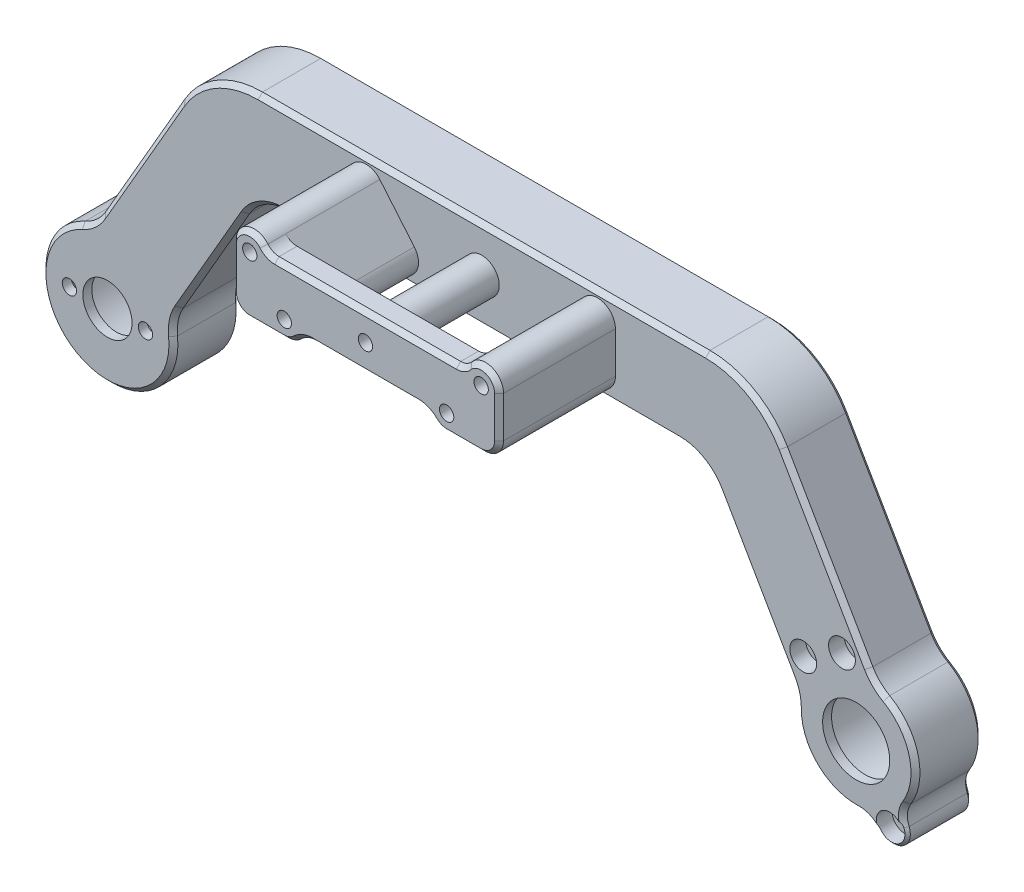
from build123d import *

# Parameters (mm, degrees)
BOSS_EXTRUDE1_DEPTH             = 7.5
CUT_EXTRUDE1_DEPTH              = 111.578168244
CUT_EXTRUDE1_DEPTH_BACK         = 111.578168244
SKETCH3_R                       = 1.6
SKETCH4_R                       = 1.6
BOSS_EXTRUDE2_DEPTH             = 21
BOSS_EXTRUDE2_2_DEPTH           = 21
SKETCH4_R_2                     = 3.9
BOSS_EXTRUDE2_3_DEPTH           = 21
BOSS_EXTRUDE3_START             = 5
SKETCH4_3_R                     = 1.6
SKETCH4_3_R_2                   = 3.9
BOSS_EXTRUDE3_DEPTH             = 5
CHAMFER1_SIZE                   = 1
BOSS_EXTRUDE4_REACH             = 117.298
SKETCH5_R                       = 13.25
SKETCH5_R_2                     = 11.25
BOSS_EXTRUDE4_DIRECTION_2_REACH = 117.298
CUT_EXTRUDE2_DEPTH              = 120.592667834
CUT_EXTRUDE2_DEPTH_BACK         = 120.592667834
SKETCH5_3_R                     = 11.25
BOSS_EXTRUDE5_START             = 5.5
SKETCH5_4_R                     = 11.25
SKETCH5_4_R_2                   = 7.5
BOSS_EXTRUDE5_DEPTH             = 2
CUT_EXTRUDE3_DEPTH              = 120.592667834
CUT_EXTRUDE3_DEPTH_BACK         = 120.592667834
SKETCH5_5_R                     = 12.75
BOSS_EXTRUDE6_START             = -7.5
BOSS_EXTRUDE6_DEPTH             = 15
BOSS_EXTRUDE7_START             = 5.5
SKETCH5_7_R                     = 12.75
SKETCH5_7_R_2                   = 1.6
SKETCH5_7_R_3                   = 5.5
BOSS_EXTRUDE7_DEPTH             = 2
FILLET1_R                       = 10
BOSS_EXTRUDE8_START             = -7.5
BOSS_EXTRUDE8_OUTLINE_R         = 1.6
BOSS_EXTRUDE8_DEPTH             = 15
CUT_EXTRUDE4_DEPTH              = 123.546948151
CUT_EXTRUDE4_DEPTH_BACK         = 123.546948151
SKETCH6_3_R                     = 1.6
CUT_EXTRUDE5_START              = 4
SKETCH7_R                       = 3
CUT_EXTRUDE5_DEPTH              = 3.5
CHAMFER2_SIZE                   = 1


# Read off the part's stored shape, not the designer's step: Boss-Extrude6, Boss-Extrude8
with BuildPart() as part:
    # Sketch1 → Boss-Extrude1 (new, symmetric)
    with BuildSketch(Plane.XY):
        with BuildLine():
            Line((-50, 10), (50, 10))
            ThreePointArc((50, 10), (60, 7.320508076), (67.320508076, 0))
            Line((67.320508076, 0), (92.320508076, -43.301270189))
            ThreePointArc((92.320508076, -43.301270189), (88.660254038, -56.961524227), (75, -53.301270189))
            Line((75, -53.301270189), (50, -10))
            Line((50, -10), (-50, -10))
            Line((-50, -10), (-75, -53.301270189))
            ThreePointArc((-75, -53.301270189), (-88.660254038, -56.961524227), (-92.320508076, -43.301270189))
            Line((-92.320508076, -43.301270189), (-67.320508076, 0))
            ThreePointArc((-67.320508076, 0), (-60, 7.320508076), (-50, 10))
        make_face()
    extrude(amount=BOSS_EXTRUDE1_DEPTH, both=True)

    # Sketch3 → Cut-Extrude1 (cut, two sides: drawn at the far end of the back side and taken through both)
    with BuildSketch(Plane.XY.offset(-CUT_EXTRUDE1_DEPTH_BACK)):
        Circle(SKETCH3_R)
        with Locations((25.856725658, 4.596266659)):
            Circle(SKETCH3_R)
        with Locations((18.143274342, -4.596266659)):
            Circle(SKETCH3_R)
        with Locations(Location((-25.856725658, 4.596266659, 0), (0, 0, 180))):
            Circle(SKETCH3_R)
        with Locations(Location((-18.143274342, -4.596266659, 0), (0, 0, 180))):
            Circle(SKETCH3_R)
    extrude(amount=CUT_EXTRUDE1_DEPTH + CUT_EXTRUDE1_DEPTH_BACK, mode=Mode.SUBTRACT)

    # Boss-Extrude4: up to this face of the body (flat: up to its plane)
    boss_extrude4_end = Plane(part.part.faces().sort_by_distance((0, 8.006158576, 7.5))[0])
    # Sketch5 → Boss-Extrude4 (add, up to the picked face)
    with BuildSketch(Plane.XY, mode=Mode.PRIVATE) as boss_extrude4_sk1:
        with Locations((83.660254038, -48.301270189)):
            Circle(SKETCH5_R)
        with Locations((83.660254038, -48.301270189)):
            Circle(SKETCH5_R_2, mode=Mode.SUBTRACT)
    boss_extrude4_tool1 = split(extrude(boss_extrude4_sk1.sketch, amount=BOSS_EXTRUDE4_REACH, mode=Mode.PRIVATE), bisect_by=boss_extrude4_end, keep=Keep.BOTH, mode=Mode.PRIVATE)
    add(boss_extrude4_tool1.solids().sort_by(Axis((70.785021, -48.30127, 0), (0, 0, 1)))[0])

    # Boss-Extrude4 direction 2: up to this face of the body (flat: up to its plane)
    boss_extrude4_direction_2_end = Plane(part.part.faces().sort_by_distance((0, 8.006158576, -7.5))[0])
    # Sketch5 → Boss-Extrude4 direction 2 (add, up to the picked face)
    with BuildSketch(Plane.XY, mode=Mode.PRIVATE) as boss_extrude4_direction_2_sk1:
        with Locations((83.660254038, -48.301270189)):
            Circle(SKETCH5_R)
        with Locations((83.660254038, -48.301270189)):
            Circle(SKETCH5_R_2, mode=Mode.SUBTRACT)
    boss_extrude4_direction_2_tool1 = split(extrude(boss_extrude4_direction_2_sk1.sketch, amount=-BOSS_EXTRUDE4_DIRECTION_2_REACH, mode=Mode.PRIVATE), bisect_by=boss_extrude4_direction_2_end, keep=Keep.BOTH, mode=Mode.PRIVATE)
    add(boss_extrude4_direction_2_tool1.solids().sort_by(Axis((70.785021, -48.30127, 0), (0, 0, -1)))[0])

    # Sketch5<3> → Cut-Extrude2 (cut, two sides: drawn at the far end of the back side and taken through both)
    with BuildSketch(Plane.XY.offset(-CUT_EXTRUDE2_DEPTH_BACK)):
        with Locations(Location((83.660254038, -48.301270189, 0), (0, 0, 180))):
            Circle(SKETCH5_3_R)
    extrude(amount=CUT_EXTRUDE2_DEPTH + CUT_EXTRUDE2_DEPTH_BACK, mode=Mode.SUBTRACT)

    # Sketch5<4> → Boss-Extrude5 (add)
    with BuildSketch(Plane.XY.offset(BOSS_EXTRUDE5_START)):
        with Locations(Location((83.660254038, -48.301270189, 0), (0, 0, 180))):
            Circle(SKETCH5_4_R)
        with Locations(Location((83.660254038, -48.301270189, 0), (0, 0, 180))):
            Circle(SKETCH5_4_R_2, mode=Mode.SUBTRACT)
    extrude(amount=BOSS_EXTRUDE5_DEPTH)

    # Sketch5<5> → Cut-Extrude3 (cut, two sides: drawn at the far end of the back side and taken through both)
    with BuildSketch(Plane.XY.offset(-CUT_EXTRUDE3_DEPTH_BACK)):
        with Locations((-83.660254038, -48.301270189)):
            Circle(SKETCH5_5_R)
    extrude(amount=CUT_EXTRUDE3_DEPTH + CUT_EXTRUDE3_DEPTH_BACK, mode=Mode.SUBTRACT)

    # Boss-Extrude6 outline → Boss-Extrude6 (add)
    with BuildSketch(Plane.XY.offset(BOSS_EXTRUDE6_START)):
        with BuildLine():
            ThreePointArc((-71.045176995, -46.45131581), (-90.035254038, -59.343094087), (-88.365685071, -36.45131581))
            Line((-88.365685071, -36.45131581), (-86.899195965, -33.91128217))
            ThreePointArc((-86.899195965, -33.91128217), (-91.035254037, -61.075144895), (-69.578687889, -43.91128217))
            Line((-69.578687889, -43.91128217), (-71.045176995, -46.45131581))
        make_face()
    extrude(amount=BOSS_EXTRUDE6_DEPTH)

    # Sketch5<7> → Boss-Extrude7 (add)
    with BuildSketch(Plane.XY.offset(BOSS_EXTRUDE7_START)):
        with Locations((-83.660254038, -48.301270189)):
            Circle(SKETCH5_7_R)
        with Locations(Location((-92.160254038, -48.301270189, 0), (0, 0, 180))):
            Circle(SKETCH5_7_R_2, mode=Mode.SUBTRACT)
        with Locations(Location((-83.660254038, -48.301270189, 0), (0, 0, 180))):
            Circle(SKETCH5_7_R_3, mode=Mode.SUBTRACT)
        with Locations(Location((-75.160254038, -48.301270189, 0), (0, 0, 180))):
            Circle(SKETCH5_7_R_2, mode=Mode.SUBTRACT)
    extrude(amount=BOSS_EXTRUDE7_DEPTH)

    # Fillet1
    fillet1_edges = [part.edges().sort_by_distance(p)[0] for p in [
        (-86.899195965, -33.91128217, 0),
        (-69.578687889, -43.91128217, 0),
        (50, -10, 0),
        (-50, -10, 0),
        (70.653665337, -45.773197727, 0),
        (87.974173413, -35.773197727, 0),
    ]]
    fillet(fillet1_edges, radius=FILLET1_R)

    # Boss-Extrude8 outline → Boss-Extrude8 (add)
    with BuildSketch(Plane.XY.offset(BOSS_EXTRUDE8_START)):
        with BuildLine():
            ThreePointArc((94.877990144, -55.352858426), (90.285254038, -59.776106789), (84.158240535, -61.541908748))
            ThreePointArc((84.158240535, -61.541908748), (86.46915215, -62.011467228), (88.307842566, -63.487954685))
            ThreePointArc((88.307842566, -63.487954685), (92.960254038, -64.4093427), (94.488514346, -59.919542169))
            ThreePointArc((94.488514346, -59.919542169), (94.129183909, -57.58894583), (94.877990144, -55.352858426))
        make_face()
        with Locations((91.160254038, -61.291651246)):
            Circle(BOSS_EXTRUDE8_OUTLINE_R, mode=Mode.SUBTRACT)
    extrude(amount=BOSS_EXTRUDE8_DEPTH)

    # Sketch6<3> → Cut-Extrude4 (cut, two sides: drawn at the far end of the back side and taken through both)
    with BuildSketch(Plane.XY.offset(-CUT_EXTRUDE4_DEPTH_BACK)):
        with Locations((71.830127019, -37.810889132)):
            Circle(SKETCH6_3_R)
        with Locations((80.490381057, -32.810889132)):
            Circle(SKETCH6_3_R)
        with Locations(Location((91.160254038, -61.291651246, 0), (0, 0, 180))):
            Circle(SKETCH6_3_R)
    extrude(amount=CUT_EXTRUDE4_DEPTH + CUT_EXTRUDE4_DEPTH_BACK, mode=Mode.SUBTRACT)

    # Sketch7 → Cut-Extrude5 (cut)
    with BuildSketch(Plane.XY.offset(CUT_EXTRUDE5_START)):
        with Locations(Location((80.490381057, -32.810889132, 0), (0, 0, 180))):
            Circle(SKETCH7_R)
        with Locations(Location((71.830127019, -37.810889132, 0), (0, 0, 180))):
            Circle(SKETCH7_R)
        with Locations(Location((91.160254038, -61.291651246, 0), (0, 0, 180))):
            Circle(SKETCH7_R)
    extrude(amount=CUT_EXTRUDE5_DEPTH, mode=Mode.SUBTRACT)

    # Chamfer2
    # the kernel refuses this chamfer: 1 mm, written as the material it takes off along each edge
    with BuildSketch(Plane(origin=(-85.03074642, -30.675032626, -7.5), x_dir=(-0.023812127644088462, 0.013747938305292346, 0.9996219169112968), z_dir=(0.5000000000000039, 0.8660254037844364, 0))) as chamfer2_piece_1:
        Polygon((CHAMFER2_SIZE * 0.999621916911, CHAMFER2_SIZE * 0.0274958766106), (-CHAMFER2_SIZE * 0.0274958766106, CHAMFER2_SIZE * 0.999621916911), (0, 0), align=None)
    extrude(amount=35.420476688, mode=Mode.SUBTRACT)
    with BuildSketch(Plane(origin=(-50, -10, 7.5), x_dir=(-0.8660254037844343, 0.5000000000000077, 0), z_dir=(-0.5000000000000077, -0.8660254037844343, 0))) as chamfer2_piece_2:
        Polygon((20, CHAMFER2_SIZE), (20 - CHAMFER2_SIZE, 0), (20, 0), align=None)
    revolve(axis=Axis((-50, -10, 7.5), (0, 0, -1)), revolution_arc=60, mode=Mode.SUBTRACT)
    with BuildSketch(Plane(origin=(83.660254038, -48.301270189, 7.5), x_dir=(0.49000237526877505, 0.8717210977319286, 0), z_dir=(-0.8717210977319286, 0.49000237526877505, 0))) as chamfer2_piece_3:
        Polygon((13.25, CHAMFER2_SIZE), (13.25 - CHAMFER2_SIZE, 0), (13.25, 0), align=None)
    revolve(axis=Axis((83.660254038, -48.301270189, 7.5), (0, 0, -1)), revolution_arc=92.813167669, mode=Mode.SUBTRACT)
    with BuildSketch(Plane(origin=(83.660254038, -48.301270189, -7.5), x_dir=(-0.9999338032850952, 0.011506043968479752, 0), z_dir=(0.011506043968479752, 0.9999338032850952, 0))) as chamfer2_piece_4:
        Polygon((13.25, CHAMFER2_SIZE), (13.25 - CHAMFER2_SIZE, 0), (13.25, 0), align=None)
    revolve(axis=Axis((83.660254038, -48.301270189, -7.5), (0, 0, 1)), revolution_arc=92.81316767, mode=Mode.SUBTRACT)
    with BuildSketch(Plane(origin=(-50, -10, -7.5), x_dir=(-0.8660254037844343, 0.5000000000000077, 0), z_dir=(-0.5000000000000077, -0.8660254037844343, 0))) as chamfer2_piece_5:
        Polygon((20, -CHAMFER2_SIZE), (20 - CHAMFER2_SIZE, 0), (20, 0), align=None)
    revolve(axis=Axis((-50, -10, -7.5), (0, 0, -1)), revolution_arc=60, mode=Mode.SUBTRACT)
    with BuildSketch(Plane(origin=(67.320508076, 0, -7.5), x_dir=(0.023812127644087928, 0.013747938305292062, 0.9996219169112968), z_dir=(0.5000000000000047, -0.866025403784436, 0))) as chamfer2_piece_6:
        Polygon((CHAMFER2_SIZE * 0.999621916911, CHAMFER2_SIZE * 0.0274958766106), (-CHAMFER2_SIZE * 0.0274958766106, CHAMFER2_SIZE * 0.999621916911), (0, 0), align=None)
    extrude(amount=38.144094299, mode=Mode.SUBTRACT)
    with BuildSketch(Plane(origin=(67.320508076, 0, 7.5), x_dir=(0.02381212764408793, 0.013747938305292064, -0.9996219169112968), z_dir=(0.5000000000000047, -0.866025403784436, 0))) as chamfer2_piece_7:
        Polygon((CHAMFER2_SIZE * 0.999621916911, -CHAMFER2_SIZE * 0.0274958766106), (-CHAMFER2_SIZE * 0.0274958766106, -CHAMFER2_SIZE * 0.999621916911), (0, 0), align=None)
    extrude(amount=38.144094299, mode=Mode.SUBTRACT)
    with BuildSketch(Plane(origin=(69.072047149, -43.033754667, 7.5), x_dir=(-0.02381212764408995, -0.013747938305293224, -0.9996219169112968), z_dir=(-0.5000000000000044, 0.8660254037844362, 0))) as chamfer2_piece_8:
        Polygon((CHAMFER2_SIZE * 0.999621916911, -CHAMFER2_SIZE * 0.0274958766106), (-CHAMFER2_SIZE * 0.0274958766106, -CHAMFER2_SIZE * 0.999621916911), (0, 0), align=None)
    extrude(amount=32.370591607, mode=Mode.SUBTRACT)
    with BuildSketch(Plane(origin=(69.072047149, -43.033754667, -7.5), x_dir=(-0.023812127644092938, -0.013747938305294949, 0.9996219169112965), z_dir=(-0.5000000000000044, 0.8660254037844362, 0))) as chamfer2_piece_9:
        Polygon((CHAMFER2_SIZE * 0.999621916911, CHAMFER2_SIZE * 0.0274958766106), (-CHAMFER2_SIZE * 0.0274958766106, CHAMFER2_SIZE * 0.999621916911), (0, 0), align=None)
    extrude(amount=32.370591607, mode=Mode.SUBTRACT)
    with BuildSketch(Plane(origin=(-50, 10, -7.5), x_dir=(0, 0.027495876610585623, 0.9996219169112968), z_dir=(1, 0, 0))) as chamfer2_piece_10:
        Polygon((CHAMFER2_SIZE * 0.999621916911, CHAMFER2_SIZE * 0.0274958766106), (-CHAMFER2_SIZE * 0.0274958766106, CHAMFER2_SIZE * 0.999621916911), (0, 0), align=None)
    extrude(amount=100, mode=Mode.SUBTRACT)
    with BuildSketch(Plane(origin=(-83.660254037, -48.301270189, 7.5), x_dir=(-0.40528268364964415, 0.9141914166812891, 0), z_dir=(0.9141914166812891, 0.40528268364964415, 0))) as chamfer2_piece_11:
        Polygon((14.75, -CHAMFER2_SIZE), (14.75 - CHAMFER2_SIZE, 0), (14.75, 0), align=None)
    revolve(axis=Axis((-83.660254037, -48.301270189, 7.5), (0, 0, 1)), revolution_arc=252.182314475, mode=Mode.SUBTRACT)
    with BuildSketch(Plane(origin=(-83.660254037, -48.301270189, -7.5), x_dir=(-0.40528268364964415, 0.9141914166812891, 0), z_dir=(0.9141914166812891, 0.40528268364964415, 0))) as chamfer2_piece_12:
        Polygon((14.75, CHAMFER2_SIZE), (14.75 - CHAMFER2_SIZE, 0), (14.75, 0), align=None)
    revolve(axis=Axis((-83.660254037, -48.301270189, -7.5), (0, 0, 1)), revolution_arc=252.182314475, mode=Mode.SUBTRACT)
    with BuildSketch(Plane(origin=(50, -10, -7.5), x_dir=(0, 1, 0), z_dir=(-1, 0, 0))) as chamfer2_piece_13:
        Polygon((20, -CHAMFER2_SIZE), (20 - CHAMFER2_SIZE, 0), (20, 0), align=None)
    revolve(axis=Axis((50, -10, -7.5), (0, 0, -1)), revolution_arc=60, mode=Mode.SUBTRACT)
    with BuildSketch(Plane(origin=(-52.886751346, -15, -7.5), x_dir=(0.023812127644087716, -0.01374793830529191, 0.9996219169112968), z_dir=(-0.5000000000000038, -0.8660254037844366, 0))) as chamfer2_piece_14:
        Polygon((CHAMFER2_SIZE * 0.999621916911, CHAMFER2_SIZE * 0.0274958766106), (-CHAMFER2_SIZE * 0.0274958766106, CHAMFER2_SIZE * 0.999621916911), (0, 0), align=None)
    extrude(amount=29.646973996, mode=Mode.SUBTRACT)
    with BuildSketch(Plane(origin=(-52.886751346, -15, 7.5), x_dir=(0.02381212764408697, -0.013747938305291477, -0.9996219169112968), z_dir=(-0.5000000000000038, -0.8660254037844366, 0))) as chamfer2_piece_15:
        Polygon((CHAMFER2_SIZE * 0.999621916911, -CHAMFER2_SIZE * 0.0274958766106), (-CHAMFER2_SIZE * 0.0274958766106, -CHAMFER2_SIZE * 0.999621916911), (0, 0), align=None)
    extrude(amount=29.646973996, mode=Mode.SUBTRACT)
    with BuildSketch(Plane(origin=(44.226497308, -10, -7.5), x_dir=(0, -0.027495876610585623, 0.9996219169112968), z_dir=(-1, 0, 0))) as chamfer2_piece_16:
        Polygon((CHAMFER2_SIZE * 0.999621916911, CHAMFER2_SIZE * 0.0274958766106), (-CHAMFER2_SIZE * 0.0274958766106, CHAMFER2_SIZE * 0.999621916911), (0, 0), align=None)
    extrude(amount=88.452994616, mode=Mode.SUBTRACT)
    with BuildSketch(Plane(origin=(44.226497308, -10, 7.5), x_dir=(0, -0.027495876610585623, -0.9996219169112968), z_dir=(-1, 0, 0))) as chamfer2_piece_17:
        Polygon((CHAMFER2_SIZE * 0.999621916911, -CHAMFER2_SIZE * 0.0274958766106), (-CHAMFER2_SIZE * 0.0274958766106, -CHAMFER2_SIZE * 0.999621916911), (0, 0), align=None)
    extrude(amount=88.452994616, mode=Mode.SUBTRACT)
    with BuildSketch(Plane(origin=(95.052809263, -28.033754667, 7.5), x_dir=(-0.49000237526877577, -0.8717210977319282, 0), z_dir=(0.8717210977319282, -0.49000237526877577, 0))) as chamfer2_piece_18:
        Polygon((10, CHAMFER2_SIZE), (10 + CHAMFER2_SIZE, 0), (10, 0), align=None)
    revolve(axis=Axis((95.052809263, -28.033754667, 7.5), (0, 0, -1)), revolution_arc=30.659262305, mode=Mode.SUBTRACT)
    with BuildSketch(Plane(origin=(95.052809263, -28.033754667, -7.5), x_dir=(-0.49000237526877577, -0.8717210977319282, 0), z_dir=(0.8717210977319282, -0.49000237526877577, 0))) as chamfer2_piece_19:
        Polygon((10, -CHAMFER2_SIZE), (10 + CHAMFER2_SIZE, 0), (10, 0), align=None)
    revolve(axis=Axis((95.052809263, -28.033754667, -7.5), (0, 0, -1)), revolution_arc=30.659262305, mode=Mode.SUBTRACT)
    with BuildSketch(Plane(origin=(60.411793111, -48.033754667, -7.5), x_dir=(0.9999338032850952, -0.011506043968478964, 0), z_dir=(-0.011506043968478964, -0.9999338032850952, 0))) as chamfer2_piece_20:
        Polygon((10, CHAMFER2_SIZE), (10 + CHAMFER2_SIZE, 0), (10, 0), align=None)
    revolve(axis=Axis((60.411793111, -48.033754667, -7.5), (0, 0, 1)), revolution_arc=30.659262305, mode=Mode.SUBTRACT)
    with BuildSketch(Plane(origin=(60.411793111, -48.033754667, 7.5), x_dir=(0.9999338032850952, -0.011506043968478964, 0), z_dir=(-0.011506043968478964, -0.9999338032850952, 0))) as chamfer2_piece_21:
        Polygon((10, -CHAMFER2_SIZE), (10 + CHAMFER2_SIZE, 0), (10, 0), align=None)
    revolve(axis=Axis((60.411793111, -48.033754667, 7.5), (0, 0, 1)), revolution_arc=30.659262305, mode=Mode.SUBTRACT)
    with BuildSketch(Plane(origin=(-93.691000458, -25.675032626, -7.5), x_dir=(0.40528268364964504, -0.9141914166812889, 0), z_dir=(-0.9141914166812889, -0.40528268364964504, 0))) as chamfer2_piece_22:
        Polygon((10, CHAMFER2_SIZE), (10 + CHAMFER2_SIZE, 0), (10, 0), align=None)
    revolve(axis=Axis((-93.691000458, -25.675032626, -7.5), (0, 0, 1)), revolution_arc=36.091157236, mode=Mode.SUBTRACT)
    with BuildSketch(Plane(origin=(-93.691000458, -25.675032626, 7.5), x_dir=(0.40528268364964504, -0.9141914166812889, 0), z_dir=(-0.9141914166812889, -0.40528268364964504, 0))) as chamfer2_piece_23:
        Polygon((10, -CHAMFER2_SIZE), (10 + CHAMFER2_SIZE, 0), (10, 0), align=None)
    revolve(axis=Axis((-93.691000458, -25.675032626, 7.5), (0, 0, 1)), revolution_arc=36.091157236, mode=Mode.SUBTRACT)
    with BuildSketch(Plane(origin=(-59.049984306, -45.675032625, 7.5), x_dir=(-0.8660254037844359, 0.5000000000000047, 0), z_dir=(0.5000000000000047, 0.8660254037844359, 0))) as chamfer2_piece_24:
        Polygon((10, -CHAMFER2_SIZE), (10 + CHAMFER2_SIZE, 0), (10, 0), align=None)
    revolve(axis=Axis((-59.049984306, -45.675032625, 7.5), (0, 0, 1)), revolution_arc=36.091157239, mode=Mode.SUBTRACT)
    with BuildSketch(Plane(origin=(-59.049984306, -45.675032625, -7.5), x_dir=(-0.8660254037844369, 0.5000000000000029, 0), z_dir=(0.5000000000000029, 0.8660254037844369, 0))) as chamfer2_piece_25:
        Polygon((10, CHAMFER2_SIZE), (10 + CHAMFER2_SIZE, 0), (10, 0), align=None)
    revolve(axis=Axis((-59.049984306, -45.675032625, -7.5), (0, 0, 1)), revolution_arc=36.091157239, mode=Mode.SUBTRACT)
    with BuildSketch(Plane(origin=(44.226497308, -20, -7.5), x_dir=(0.8660254037844365, 0.5000000000000038, 0), z_dir=(0.5000000000000038, -0.8660254037844365, 0))) as chamfer2_piece_26:
        Polygon((10, CHAMFER2_SIZE), (10 + CHAMFER2_SIZE, 0), (10, 0), align=None)
    revolve(axis=Axis((44.226497308, -20, -7.5), (0, 0, 1)), revolution_arc=60, mode=Mode.SUBTRACT)
    with BuildSketch(Plane(origin=(44.226497308, -20, 7.5), x_dir=(0.8660254037844359, 0.5000000000000046, 0), z_dir=(0.5000000000000046, -0.8660254037844359, 0))) as chamfer2_piece_27:
        Polygon((10, -CHAMFER2_SIZE), (10 + CHAMFER2_SIZE, 0), (10, 0), align=None)
    revolve(axis=Axis((44.226497308, -20, 7.5), (0, 0, 1)), revolution_arc=60, mode=Mode.SUBTRACT)
    with BuildSketch(Plane(origin=(-44.226497308, -20, -7.5), x_dir=(0, 1, 0), z_dir=(1, 0, 0))) as chamfer2_piece_28:
        Polygon((10, CHAMFER2_SIZE), (10 + CHAMFER2_SIZE, 0), (10, 0), align=None)
    revolve(axis=Axis((-44.226497308, -20, -7.5), (0, 0, 1)), revolution_arc=60, mode=Mode.SUBTRACT)
    with BuildSketch(Plane(origin=(-44.226497308, -20, 7.5), x_dir=(0, 1, 0), z_dir=(1, 0, 0))) as chamfer2_piece_29:
        Polygon((10, -CHAMFER2_SIZE), (10 + CHAMFER2_SIZE, 0), (10, 0), align=None)
    revolve(axis=Axis((-44.226497308, -20, 7.5), (0, 0, 1)), revolution_arc=60, mode=Mode.SUBTRACT)
    with BuildSketch(Plane(origin=(-85.03074642, -30.675032626, 7.5), x_dir=(-0.023812127644088462, 0.013747938305292346, -0.9996219169112968), z_dir=(0.5000000000000039, 0.8660254037844364, 0))) as chamfer2_piece_30:
        Polygon((CHAMFER2_SIZE * 0.999621916911, -CHAMFER2_SIZE * 0.0274958766106), (-CHAMFER2_SIZE * 0.0274958766106, -CHAMFER2_SIZE * 0.999621916911), (0, 0), align=None)
    extrude(amount=35.420476688, mode=Mode.SUBTRACT)
    with BuildSketch(Plane(origin=(83.660254038, -48.301270189, -7.5), x_dir=(0.8466215928971065, -0.5321953386120232, 0), z_dir=(-0.5321953386120232, -0.8466215928971065, 0))) as chamfer2_piece_31:
        Polygon((13.25, CHAMFER2_SIZE), (13.25 - CHAMFER2_SIZE, 0), (13.25, 0), align=None)
    revolve(axis=Axis((83.660254038, -48.301270189, -7.5), (0, 0, 1)), revolution_arc=92.813167669, mode=Mode.SUBTRACT)
    with BuildSketch(Plane(origin=(83.660254038, -48.301270189, 7.5), x_dir=(0.03758388657824293, -0.9992934761468593, 0), z_dir=(0.9992934761468593, 0.03758388657824293, 0))) as chamfer2_piece_32:
        Polygon((13.25, CHAMFER2_SIZE), (13.25 - CHAMFER2_SIZE, 0), (13.25, 0), align=None)
    revolve(axis=Axis((83.660254038, -48.301270189, 7.5), (0, 0, -1)), revolution_arc=92.81316767, mode=Mode.SUBTRACT)
    with BuildSketch(Plane(origin=(91.160254038, -61.291651247, 7.5), x_dir=(-0.7923365200184813, -0.6100842884757833, 0), z_dir=(-0.6100842884757833, 0.7923365200184813, 0))) as chamfer2_piece_33:
        Polygon((3.6, -CHAMFER2_SIZE), (3.6 - CHAMFER2_SIZE, 0), (3.6, 0), align=None)
    revolve(axis=Axis((91.160254038, -61.291651247, 7.5), (0, 0, 1)), revolution_arc=164.808804361, mode=Mode.SUBTRACT)
    with BuildSketch(Plane(origin=(91.160254038, -61.291651247, -7.5), x_dir=(-0.7923365200184813, -0.6100842884757833, 0), z_dir=(-0.6100842884757833, 0.7923365200184813, 0))) as chamfer2_piece_34:
        Polygon((3.6, CHAMFER2_SIZE), (3.6 - CHAMFER2_SIZE, 0), (3.6, 0), align=None)
    revolve(axis=Axis((91.160254038, -61.291651247, -7.5), (0, 0, 1)), revolution_arc=164.808804361, mode=Mode.SUBTRACT)
    with BuildSketch(Plane(origin=(99.11109811, -58.013835119, 7.5), x_dir=(-0.9245167525351079, -0.381141409823097, 0), z_dir=(0.381141409823097, -0.9245167525351079, 0))) as chamfer2_piece_35:
        Polygon((5.000000001, CHAMFER2_SIZE), (5.000000001 + CHAMFER2_SIZE, 0), (5.000000001, 0), align=None)
    revolve(axis=Axis((99.11109811, -58.013835119, 7.5), (0, 0, -1)), revolution_arc=54.558307499, mode=Mode.SUBTRACT)
    with BuildSketch(Plane(origin=(99.11109811, -58.013835119, -7.5), x_dir=(-0.9245167525351079, -0.381141409823097, 0), z_dir=(0.381141409823097, -0.9245167525351079, 0))) as chamfer2_piece_36:
        Polygon((5.000000001 + CHAMFER2_SIZE, 0), (5.000000001, -CHAMFER2_SIZE), (5.000000001, 0), align=None)
    revolve(axis=Axis((99.11109811, -58.013835119, -7.5), (0, 0, -1)), revolution_arc=54.558307499, mode=Mode.SUBTRACT)
    with BuildSketch(Plane(origin=(84.346159969, -66.538376125, 7.5), x_dir=(-0.03758388681001505, 0.9992934761381423, 0), z_dir=(-0.9992934761381423, -0.03758388681001505, 0))) as chamfer2_piece_37:
        Polygon((4.999999996, CHAMFER2_SIZE), (4.999999996 + CHAMFER2_SIZE, 0), (4.999999996, 0), align=None)
    revolve(axis=Axis((84.346159969, -66.538376125, 7.5), (0, 0, -1)), revolution_arc=54.558307562, mode=Mode.SUBTRACT)
    with BuildSketch(Plane(origin=(84.346159969, -66.538376125, -7.5), x_dir=(-0.03758388681001505, 0.9992934761381423, 0), z_dir=(-0.9992934761381423, -0.03758388681001505, 0))) as chamfer2_piece_38:
        Polygon((4.999999996, -CHAMFER2_SIZE), (4.999999996 + CHAMFER2_SIZE, 0), (4.999999996, 0), align=None)
    revolve(axis=Axis((84.346159969, -66.538376125, -7.5), (0, 0, -1)), revolution_arc=54.558307562, mode=Mode.SUBTRACT)
    with BuildSketch(Plane(origin=(50, -10, 7.5), x_dir=(0, 1, 0), z_dir=(-1, 0, 0))) as chamfer2_piece_39:
        Polygon((20, CHAMFER2_SIZE), (20 - CHAMFER2_SIZE, 0), (20, 0), align=None)
    revolve(axis=Axis((50, -10, 7.5), (0, 0, -1)), revolution_arc=60, mode=Mode.SUBTRACT)
    with BuildSketch(Plane(origin=(-50, 10, 7.5), x_dir=(0, 0.027495876610585623, -0.9996219169112968), z_dir=(1, 0, 0))) as chamfer2_piece_40:
        Polygon((CHAMFER2_SIZE * 0.999621916911, -CHAMFER2_SIZE * 0.0274958766106), (-CHAMFER2_SIZE * 0.0274958766106, -CHAMFER2_SIZE * 0.999621916911), (0, 0), align=None)
    extrude(amount=100, mode=Mode.SUBTRACT)


with BuildPart() as body_2:
    # Sketch4 → Boss-Extrude2 (new body)
    with BuildSketch(Plane.XY.offset(28.5)):
        with BuildLine():
            Line((-25.856725658, -8.596266659), (-18.143274342, -8.596266659))
            ThreePointArc((-18.143274342, -8.596266659), (-14.518043194, -6.286739706), (-15.079096569, -2.02511622))
            Line((-15.079096569, -2.02511622), (-22.792547886, 7.167417097))
            ThreePointArc((-22.792547886, 7.167417097), (-27.224806231, 8.355037142), (-29.856725658, 4.596266659))
            Line((-29.856725658, 4.596266659), (-29.856725658, -4.596266659))
            ThreePointArc((-29.856725658, -4.596266659), (-28.685152783, -7.424693783), (-25.856725658, -8.596266659))
        make_face()
        with Locations((-18.143274342, -4.596266659)):
            Circle(SKETCH4_R, mode=Mode.SUBTRACT)
        with Locations((-25.856725658, 4.596266659)):
            Circle(SKETCH4_R, mode=Mode.SUBTRACT)
    extrude(amount=-BOSS_EXTRUDE2_DEPTH)



with BuildPart() as body_3:
    # Sketch4 → Boss-Extrude2 2 (new body)
    with BuildSketch(Plane.XY.offset(28.5)):
        with BuildLine():
            ThreePointArc((18.143274342, -8.596266659), (14.518043194, -6.286739706), (15.079096569, -2.02511622))
            Line((15.079096569, -2.02511622), (22.792547886, 7.167417097))
            ThreePointArc((22.792547886, 7.167417097), (27.224806231, 8.355037142), (29.856725658, 4.596266659))
            Line((29.856725658, 4.596266659), (29.856725658, -4.596266659))
            ThreePointArc((29.856725658, -4.596266659), (28.685152783, -7.424693783), (25.856725658, -8.596266659))
            Line((25.856725658, -8.596266659), (18.143274342, -8.596266659))
        make_face()
        with Locations((18.143274342, -4.596266659)):
            Circle(SKETCH4_R, mode=Mode.SUBTRACT)
        with Locations((25.856725658, 4.596266659)):
            Circle(SKETCH4_R, mode=Mode.SUBTRACT)
    extrude(amount=-BOSS_EXTRUDE2_2_DEPTH)


with BuildPart() as body_4:
    # Sketch4 → Boss-Extrude2 3 (new body)
    with BuildSketch(Plane.XY.offset(28.5)):
        Circle(SKETCH4_R_2)
        Circle(SKETCH4_R, mode=Mode.SUBTRACT)
    extrude(amount=-BOSS_EXTRUDE2_3_DEPTH)


with BuildPart() as body_2_1:
    add(body_2.part)

    add(body_3.part)  # Boss-Extrude3 merges body 3

    add(body_4.part)  # Boss-Extrude3 merges body 4
    # Sketch4<3> → Boss-Extrude3 (add)
    # profile 1 of 5: a face of its own
    with BuildSketch(Plane.XY.offset(28.5).offset(BOSS_EXTRUDE3_START)):
        with BuildLine():
            Line((-25.856725658, -8.596266659), (-18.143274342, -8.596266659))
            ThreePointArc((-18.143274342, -8.596266659), (-14.518043194, -6.286739706), (-15.079096569, -2.02511622))
            Line((-15.079096569, -2.02511622), (-22.792547886, 7.167417097))
            ThreePointArc((-22.792547886, 7.167417097), (-27.224806231, 8.355037142), (-29.856725658, 4.596266659))
            Line((-29.856725658, 4.596266659), (-29.856725658, -4.596266659))
            ThreePointArc((-29.856725658, -4.596266659), (-28.685152783, -7.424693783), (-25.856725658, -8.596266659))
        make_face()
        with Locations((-18.143274342, -4.596266659)):
            Circle(SKETCH4_3_R, mode=Mode.SUBTRACT)
        with Locations((-25.856725658, 4.596266659)):
            Circle(SKETCH4_3_R, mode=Mode.SUBTRACT)
    # profile 2 of 5: a face of its own
    with BuildSketch(Plane.XY.offset(28.5).offset(BOSS_EXTRUDE3_START)):
        with BuildLine():
            Line((0, 3.9), (0, 6))
            Line((0, 6), (-20.289013841, 6))
            ThreePointArc((-20.289013841, 6), (-21.670185933, 6.306198481), (-22.792547886, 7.167417097))
            Line((-22.792547886, 7.167417097), (-15.079096569, -2.02511622))
            ThreePointArc((-15.079096569, -2.02511622), (-14.147648015, -4.783270014), (-15.332634968, -7.442370366))
            ThreePointArc((-15.332634968, -7.442370366), (-13.718263321, -6.374627141), (-11.819335752, -6))
            Line((-11.819335752, -6), (0, -6))
            Line((0, -6), (0, -3.9))
            ThreePointArc((0, -3.9), (-3.9, 0), (0, 3.9))
        make_face()
    # profile 3 of 5: a face of its own
    with BuildSketch(Plane.XY.offset(28.5).offset(BOSS_EXTRUDE3_START)):
        Circle(SKETCH4_3_R_2)
        with Locations(Location((0, 0, 0), (0, 0, 180))):
            Circle(SKETCH4_3_R, mode=Mode.SUBTRACT)
    # profile 4 of 5: a face of its own
    with BuildSketch(Plane.XY.offset(28.5).offset(BOSS_EXTRUDE3_START)):
        with BuildLine():
            ThreePointArc((15.332634968, -7.442370366), (14.147648015, -4.783270014), (15.079096569, -2.02511622))
            Line((15.079096569, -2.02511622), (22.792547886, 7.167417097))
            ThreePointArc((22.792547886, 7.167417097), (21.670185933, 6.306198481), (20.289013841, 6))
            Line((20.289013841, 6), (0, 6))
            Line((0, 6), (0, 3.9))
            ThreePointArc((0, 3.9), (2.757716447, 2.757716447), (3.9, 0))
            ThreePointArc((3.9, 0), (2.757716447, -2.757716447), (0, -3.9))
            Line((0, -3.9), (0, -6))
            Line((0, -6), (11.819335752, -6))
            ThreePointArc((11.819335752, -6), (13.718263321, -6.374627141), (15.332634968, -7.442370366))
        make_face()
    # profile 5 of 5: a face of its own
    with BuildSketch(Plane.XY.offset(28.5).offset(BOSS_EXTRUDE3_START)):
        with BuildLine():
            ThreePointArc((18.143274342, -8.596266659), (14.518043194, -6.286739706), (15.079096569, -2.02511622))
            Line((15.079096569, -2.02511622), (22.792547886, 7.167417097))
            ThreePointArc((22.792547886, 7.167417097), (27.224806231, 8.355037142), (29.856725658, 4.596266659))
            Line((29.856725658, 4.596266659), (29.856725658, -4.596266659))
            ThreePointArc((29.856725658, -4.596266659), (28.685152783, -7.424693783), (25.856725658, -8.596266659))
            Line((25.856725658, -8.596266659), (18.143274342, -8.596266659))
        make_face()
        with Locations(Location((18.143274342, -4.596266659, 0), (0, 0, 180))):
            Circle(SKETCH4_3_R, mode=Mode.SUBTRACT)
        with Locations(Location((25.856725658, 4.596266659, 0), (0, 0, 180))):
            Circle(SKETCH4_3_R, mode=Mode.SUBTRACT)
    extrude(amount=-BOSS_EXTRUDE3_DEPTH)

    # Chamfer1
    chamfer1_edges = [body_2_1.edges().sort_by_distance(p)[0] for p in [
        (16.624132286, -8.296564946, 33.5),
        (22, -8.596266659, 33.5),
        (28.685152783, -7.424693783, 33.5),
        (29.856725658, 0, 33.5),
        (27.224806231, 8.355037142, 33.5),
        (-21.670185933, 6.306198481, 33.5),
        (-13.718263321, -6.374627141, 33.5),
        (0, -6, 33.5),
        (13.718263321, -6.374627141, 33.5),
        (21.670185933, 6.306198481, 33.5),
        (0, 6, 33.5),
        (-27.224806231, 8.355037142, 33.5),
        (-29.856725658, 0, 33.5),
        (-28.685152783, -7.424693783, 33.5),
        (-22, -8.596266659, 33.5),
        (-16.624132286, -8.296564946, 33.5),
    ]]
    chamfer(chamfer1_edges, length=CHAMFER1_SIZE)


solid = Compound([part.part, body_2_1.part])
